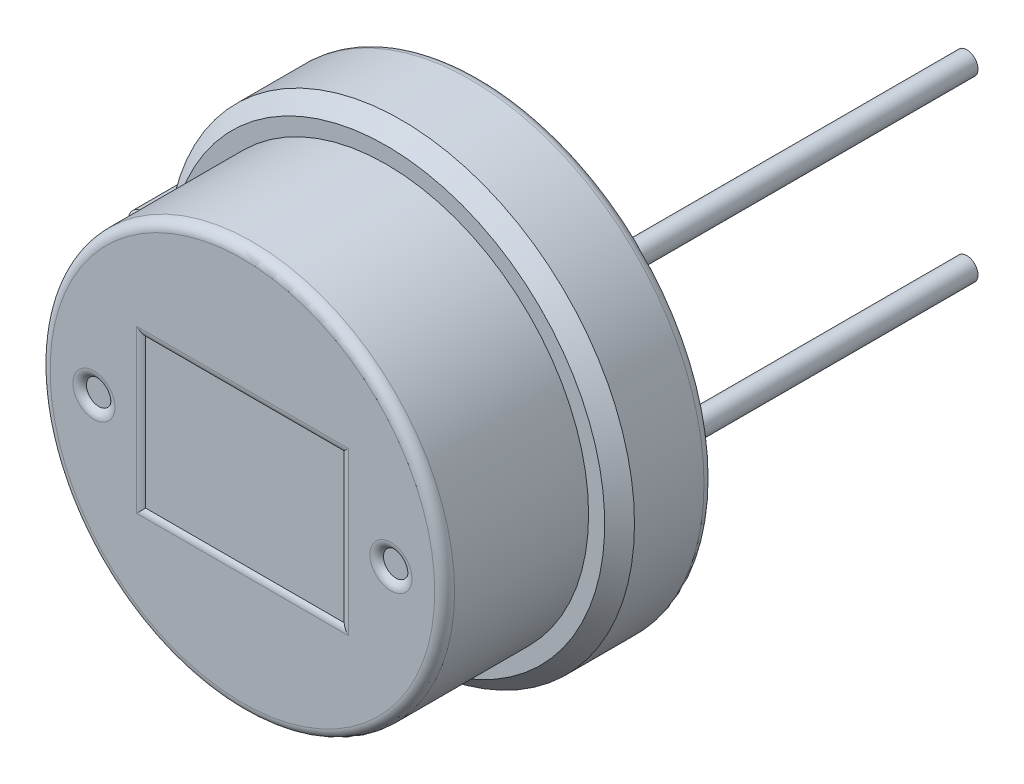
from build123d import *

# Parameters (mm, degrees)
EXTRUDE_423_DEPTH      = 1.9
SKETCH_3_R             = 4.075
EXTRUDE_611_DEPTH      = 2.9
SKETCH_6_W             = 4
SKETCH_6_H             = 3
CUT_EXTRUDE_758_DEPTH  = 0.05
SKETCH_7_R             = 0.25
CUT_EXTRUDE_1008_DEPTH = 0.1
SKETCH_4_R             = 0.225
EXTRUDE_1392_DEPTH     = 8
CHAMFER_1_SIZE         = 0.3
FILLET_1_R             = 0.2


# Some blends are built 0.0001 mm under size
with BuildPart() as part:
    # 草图2 → Extrude 423 (new body)
    with BuildSketch(Plane.XY):
        with BuildLine():
            Line((-5.5, 0.2), (-5.5, -0.2))
            ThreePointArc((-5.5, -0.2), (-5.412132034, -0.412132034), (-5.2, -0.5))
            Line((-5.2, -0.5), (-4.935585072, -0.5))
            ThreePointArc((-4.935585072, -0.5), (-4.741162851, -0.571526807), (-4.639449967, -0.752))
            ThreePointArc((-4.639449967, -0.752), (4.7, 0), (-4.639449967, 0.752))
            ThreePointArc((-4.639449967, 0.752), (-4.741162851, 0.571526807), (-4.935585072, 0.5))
            Line((-4.935585072, 0.5), (-5.2, 0.5))
            ThreePointArc((-5.2, 0.5), (-5.412132034, 0.412132034), (-5.5, 0.2))
        make_face()
    extrude(amount=EXTRUDE_423_DEPTH)

    # 草图3 → Extrude 611 (add)
    with BuildSketch(Plane.XY.offset(1.9)):
        Circle(SKETCH_3_R)
    extrude(amount=EXTRUDE_611_DEPTH)

    # 草图6 → Cut-Extrude 758 (cut)
    with BuildSketch(Plane.XY.offset(4.8)):
        Rectangle(SKETCH_6_W, SKETCH_6_H)
    extrude(amount=-CUT_EXTRUDE_758_DEPTH, mode=Mode.SUBTRACT)

    # 草图7 → Cut-Extrude 1008 (cut)
    with BuildSketch(Plane.XY.offset(4.8)):
        with Locations((-2.992635388, 0)):
            Circle(SKETCH_7_R)
        with Locations(Location((2.992635388, 0, 0), (0, 0, 180))):
            Circle(SKETCH_7_R)
    extrude(amount=-CUT_EXTRUDE_1008_DEPTH, mode=Mode.SUBTRACT)

    # 草图4 → Extrude 1392 (add)
    with BuildSketch(Plane(origin=(0, 0, 0), x_dir=(-1, 0, 0), z_dir=(0, 0, -1))):
        with Locations(Location((-1.796051224, -1.796051224, 0), (0, 0, 180))):
            Circle(SKETCH_4_R)
        with Locations(Location((-1.796051224, 1.796051224, 0), (0, 0, 180))):
            Circle(SKETCH_4_R)
        with Locations(Location((1.796051224, -1.796051224, 0), (0, 0, 180))):
            Circle(SKETCH_4_R)
    extrude(amount=EXTRUDE_1392_DEPTH)

    # 倒角1
    chamfer_1_edges = [part.edges().sort_by_distance(p)[0] for p in [
        (-4.741162851, 0.571526807, 1.9),
        (-5.067792536, 0.5, 1.9),
        (-5.412132034, 0.412132034, 1.9),
        (-5.5, 0, 1.9),
        (-5.412132034, -0.412132034, 1.9),
        (-5.067792536, -0.5, 1.9),
        (-4.741162851, -0.571526807, 1.9),
        (4.7, 0, 1.9),
    ]]
    chamfer(chamfer_1_edges, length=CHAMFER_1_SIZE - 0.0001)  # a hair under: the kernel refuses the full size

    # 圆角1
    # the kernel refuses this fillet: 0.2 mm, written as the material it takes off along each edge
    with BuildSketch(Plane(origin=(-4.935585072, -0.8, 0), x_dir=(0, 1, 0), z_dir=(-1, 0, 0))) as fillet_1_piece_1:
        with BuildLine():
            CenterArc((0.3 + FILLET_1_R, -FILLET_1_R), FILLET_1_R, 90, 90)
            Line((0.3, -FILLET_1_R), (0.3 - FILLET_1_R * 0.02, -FILLET_1_R))
            Line((0.3 - FILLET_1_R * 0.02, -FILLET_1_R), (0.3 - FILLET_1_R * 0.02, FILLET_1_R * 0.02))
            Line((0.3 - FILLET_1_R * 0.02, FILLET_1_R * 0.02), (0.3 + FILLET_1_R, FILLET_1_R * 0.02))
            Line((0.3 + FILLET_1_R, FILLET_1_R * 0.02), (0.3 + FILLET_1_R, 0))
        make_face()
    revolve(axis=Axis((-4.935585072, -0.8, 0), (0, 0, -1)), revolution_arc=80.793103779, mode=Mode.SUBTRACT)
    with BuildSketch(Plane(origin=(-5.2, -0.5, 0), x_dir=(0, 1, 0), z_dir=(1, 0, 0))) as fillet_1_piece_2:
        with BuildLine():
            CenterArc((FILLET_1_R, FILLET_1_R), FILLET_1_R, 180, 90)
            Line((0, FILLET_1_R), (-FILLET_1_R * 0.02, FILLET_1_R))
            Line((-FILLET_1_R * 0.02, FILLET_1_R), (-FILLET_1_R * 0.02, -FILLET_1_R * 0.02))
            Line((-FILLET_1_R * 0.02, -FILLET_1_R * 0.02), (FILLET_1_R, -FILLET_1_R * 0.02))
            Line((FILLET_1_R, -FILLET_1_R * 0.02), (FILLET_1_R, 0))
        make_face()
    extrude(amount=0.264414928, mode=Mode.SUBTRACT)
    with BuildSketch(Plane(origin=(-5.2, -0.2, 0), x_dir=(-1, 0, 0), z_dir=(0, 1, 0))) as fillet_1_piece_3:
        with BuildLine():
            CenterArc((0.3 - FILLET_1_R, FILLET_1_R), FILLET_1_R, 270, 90)
            Line((0.3, FILLET_1_R), (0.3 + FILLET_1_R * 0.02, FILLET_1_R))
            Line((0.3 + FILLET_1_R * 0.02, FILLET_1_R), (0.3 + FILLET_1_R * 0.02, -FILLET_1_R * 0.02))
            Line((0.3 + FILLET_1_R * 0.02, -FILLET_1_R * 0.02), (0.3 - FILLET_1_R, -FILLET_1_R * 0.02))
            Line((0.3 - FILLET_1_R, -FILLET_1_R * 0.02), (0.3 - FILLET_1_R, 0))
        make_face()
    revolve(axis=Axis((-5.2, -0.2, 0), (0, 0, 1)), revolution_arc=90, mode=Mode.SUBTRACT)
    with BuildSketch(Plane(origin=(-5.5, 0.2, 0), x_dir=(1, 0, 0), z_dir=(0, -1, 0))) as fillet_1_piece_4:
        with BuildLine():
            CenterArc((FILLET_1_R, FILLET_1_R), FILLET_1_R, 180, 90)
            Line((0, FILLET_1_R), (-FILLET_1_R * 0.02, FILLET_1_R))
            Line((-FILLET_1_R * 0.02, FILLET_1_R), (-FILLET_1_R * 0.02, -FILLET_1_R * 0.02))
            Line((-FILLET_1_R * 0.02, -FILLET_1_R * 0.02), (FILLET_1_R, -FILLET_1_R * 0.02))
            Line((FILLET_1_R, -FILLET_1_R * 0.02), (FILLET_1_R, 0))
        make_face()
    extrude(amount=0.4, mode=Mode.SUBTRACT)
    with BuildSketch(Plane(origin=(-5.2, 0.2, 0), x_dir=(0, 1, 0), z_dir=(1, 0, 0))) as fillet_1_piece_5:
        with BuildLine():
            CenterArc((0.3 - FILLET_1_R, FILLET_1_R), FILLET_1_R, 270, 90)
            Line((0.3 - FILLET_1_R, 0), (0.3 - FILLET_1_R, -FILLET_1_R * 0.02))
            Line((0.3 - FILLET_1_R, -FILLET_1_R * 0.02), (0.3 + FILLET_1_R * 0.02, -FILLET_1_R * 0.02))
            Line((0.3 + FILLET_1_R * 0.02, -FILLET_1_R * 0.02), (0.3 + FILLET_1_R * 0.02, FILLET_1_R))
            Line((0.3 + FILLET_1_R * 0.02, FILLET_1_R), (0.3, FILLET_1_R))
        make_face()
    revolve(axis=Axis((-5.2, 0.2, 0), (0, 0, 1)), revolution_arc=90, mode=Mode.SUBTRACT)
    with BuildSketch(Plane(origin=(-4.935585072, 0.5, 0), x_dir=(0, 0, 1), z_dir=(-1, 0, 0))) as fillet_1_piece_6:
        with BuildLine():
            CenterArc((FILLET_1_R, -FILLET_1_R), FILLET_1_R, 90, 90)
            Line((0, -FILLET_1_R), (-FILLET_1_R * 0.02, -FILLET_1_R))
            Line((-FILLET_1_R * 0.02, -FILLET_1_R), (-FILLET_1_R * 0.02, FILLET_1_R * 0.02))
            Line((-FILLET_1_R * 0.02, FILLET_1_R * 0.02), (FILLET_1_R, FILLET_1_R * 0.02))
            Line((FILLET_1_R, FILLET_1_R * 0.02), (FILLET_1_R, 0))
        make_face()
    extrude(amount=0.264414928, mode=Mode.SUBTRACT)
    with BuildSketch(Plane(origin=(-4.935585072, 0.8, 0), x_dir=(0.9871170143402451, -0.16000000000000056, 0), z_dir=(0.16000000000000056, 0.9871170143402451, 0))) as fillet_1_piece_7:
        with BuildLine():
            CenterArc((0.3 + FILLET_1_R, -FILLET_1_R), FILLET_1_R, 90, 90)
            Line((0.3, -FILLET_1_R), (0.3 - FILLET_1_R * 0.02, -FILLET_1_R))
            Line((0.3 - FILLET_1_R * 0.02, -FILLET_1_R), (0.3 - FILLET_1_R * 0.02, FILLET_1_R * 0.02))
            Line((0.3 - FILLET_1_R * 0.02, FILLET_1_R * 0.02), (0.3 + FILLET_1_R, FILLET_1_R * 0.02))
            Line((0.3 + FILLET_1_R, FILLET_1_R * 0.02), (0.3 + FILLET_1_R, 0))
        make_face()
    revolve(axis=Axis((-4.935585072, 0.8, 0), (0, 0, -1)), revolution_arc=80.793103779, mode=Mode.SUBTRACT)
    with BuildSketch(Plane(origin=(0, 0, 4.8), x_dir=(1, 0, 0), z_dir=(0, -1, 0))) as fillet_1_piece_8:
        with BuildLine():
            CenterArc((4.075 - FILLET_1_R, -FILLET_1_R), FILLET_1_R, 0, 90)
            Line((4.075 - FILLET_1_R, 0), (4.075 - FILLET_1_R, FILLET_1_R * 0.02))
            Line((4.075 - FILLET_1_R, FILLET_1_R * 0.02), (4.075 + FILLET_1_R * 0.02, FILLET_1_R * 0.02))
            Line((4.075 + FILLET_1_R * 0.02, FILLET_1_R * 0.02), (4.075 + FILLET_1_R * 0.02, -FILLET_1_R))
            Line((4.075 + FILLET_1_R * 0.02, -FILLET_1_R), (4.075, -FILLET_1_R))
        make_face()
    revolve(axis=Axis((0, 0, 4.8), (0, 0, 1)), mode=Mode.SUBTRACT)
    with BuildSketch(Plane(origin=(0, 0, 0), x_dir=(-0.9871170143402452, -0.16000000000000036, 0), z_dir=(-0.16000000000000036, 0.9871170143402452, 0))) as fillet_1_piece_9:
        with BuildLine():
            CenterArc((4.7 - FILLET_1_R, FILLET_1_R), FILLET_1_R, 270, 90)
            Line((4.7, FILLET_1_R), (4.7 + FILLET_1_R * 0.02, FILLET_1_R))
            Line((4.7 + FILLET_1_R * 0.02, FILLET_1_R), (4.7 + FILLET_1_R * 0.02, -FILLET_1_R * 0.02))
            Line((4.7 + FILLET_1_R * 0.02, -FILLET_1_R * 0.02), (4.7 - FILLET_1_R, -FILLET_1_R * 0.02))
            Line((4.7 - FILLET_1_R, -FILLET_1_R * 0.02), (4.7 - FILLET_1_R, 0))
        make_face()
    revolve(axis=Axis((0, 0, 0), (0, 0, 1)), revolution_arc=341.586207557, mode=Mode.SUBTRACT)
    with BuildSketch(Plane(origin=(2.992635388, 0, 4.8), x_dir=(-1, 0, 0), z_dir=(0, 1, 0))) as fillet_1_piece_10:
        with BuildLine():
            CenterArc((0.423205081, -0.2), FILLET_1_R, 90, 60)
            Line((0.25, -0.1), (0.246535898, -0.098))
            ThreePointArc((0.246535898, -0.098), (0.246, -0.05), (0.246, 0))
            Line((0.246, 0), (0.25, 0.004))
            Line((0.25, 0.004), (0.423205081, 0.004))
            Line((0.423205081, 0.004), (0.423205081, 0))
        make_face()
    revolve(axis=Axis((2.992635388, 0, 4.8), (0, 0, 1)), mode=Mode.SUBTRACT)
    with BuildSketch(Plane(origin=(-2.992635388, 0, 4.8), x_dir=(1, 0, 0), z_dir=(0, -1, 0))) as fillet_1_piece_11:
        with BuildLine():
            CenterArc((0.423205081, -0.2), FILLET_1_R, 90, 60)
            Line((0.25, -0.1), (0.246535898, -0.098))
            ThreePointArc((0.246535898, -0.098), (0.246, -0.05), (0.246, 0))
            Line((0.246, 0), (0.25, 0.004))
            Line((0.25, 0.004), (0.423205081, 0.004))
            Line((0.423205081, 0.004), (0.423205081, 0))
        make_face()
    revolve(axis=Axis((-2.992635388, 0, 4.8), (0, 0, 1)), mode=Mode.SUBTRACT)
    with BuildSketch(Plane(origin=(-2, 1.5, 4.8), x_dir=(0, 1, 0), z_dir=(1, 0, 0)), Plane(origin=(2, -1.5, 4.8), x_dir=(0, -1, 0), z_dir=(-1, 0, 0))) as fillet_1_piece_12:
        with BuildLine():
            CenterArc((0.132287566, -0.2), FILLET_1_R, 90, 41.409622109)
            Line((0, -0.05), (-0.002645751, -0.047))
            ThreePointArc((-0.002645751, -0.047), (-0.004, -0.025), (-0.004, 0))
            Line((-0.004, 0), (0, 0.004))
            Line((0, 0.004), (0.132287566, 0.004))
            Line((0.132287566, 0.004), (0.132287566, 0))
        make_face()
    extrude(amount=4, mode=Mode.SUBTRACT)
    with BuildSketch(Plane(origin=(-2, -1.5, 4.8), x_dir=(-1, 0, 0), z_dir=(0, 1, 0)), Plane(origin=(2, 1.5, 4.8), x_dir=(1, 0, 0), z_dir=(0, -1, 0))) as fillet_1_piece_13:
        with BuildLine():
            CenterArc((0.132287566, -0.2), FILLET_1_R, 90, 41.409622109)
            Line((0, -0.05), (-0.002645751, -0.047))
            ThreePointArc((-0.002645751, -0.047), (-0.004, -0.025), (-0.004, 0))
            Line((-0.004, 0), (0, 0.004))
            Line((0, 0.004), (0.132287566, 0.004))
            Line((0.132287566, 0.004), (0.132287566, 0))
        make_face()
    extrude(amount=3, mode=Mode.SUBTRACT)
    with BuildSketch(Plane(origin=(-2, -1.5, 4.8), x_dir=(-1, 0, 0), z_dir=(0, 1, 0))) as fillet_1_piece_14a_section:
        with BuildLine():
            CenterArc((0.132287566, -0.2), FILLET_1_R, 90, 41.409622109)
            Line((0, -0.05), (-0.002645751, -0.047))
            ThreePointArc((-0.002645751, -0.047), (-0.004, -0.025), (-0.004, 0))
            Line((-0.004, 0), (0, 0.004))
            Line((0, 0.004), (0.132287566, 0.004))
            Line((0.132287566, 0.004), (0.132287566, 0))
        make_face()
    fillet_1_piece_14a = extrude(amount=3.330718914, mode=Mode.PRIVATE)
    fillet_1_piece_14a = split(fillet_1_piece_14a, bisect_by=Plane(origin=(-2.036281513, 1.5, 4.788045002), z_dir=(0, 1, 0)), keep=Keep.TOP, mode=Mode.PRIVATE)
    with BuildSketch(Plane(origin=(-2.330718914, 1.5, 4.8), x_dir=(0, 1, 0), z_dir=(1, 0, 0))) as fillet_1_piece_14b_section:
        with BuildLine():
            CenterArc((0.132287566, -0.2), FILLET_1_R, 90, 41.409622109)
            Line((0, -0.05), (-0.002645751, -0.047))
            ThreePointArc((-0.002645751, -0.047), (-0.004, -0.025), (-0.004, 0))
            Line((-0.004, 0), (0, 0.004))
            Line((0, 0.004), (0.132287566, 0.004))
            Line((0.132287566, 0.004), (0.132287566, 0))
        make_face()
    fillet_1_piece_14b = extrude(amount=4.330718914, mode=Mode.PRIVATE)
    fillet_1_piece_14b = split(fillet_1_piece_14b, bisect_by=Plane(origin=(-2, 1.536281513, 4.788045002), z_dir=(-1, 0, 0)), keep=Keep.TOP, mode=Mode.PRIVATE)
    fillet_1_piece_14 = fillet_1_piece_14a & fillet_1_piece_14b
    add(fillet_1_piece_14, mode=Mode.SUBTRACT)
    with BuildSketch(Plane(origin=(-2, 1.5, 4.8), x_dir=(0, 1, 0), z_dir=(1, 0, 0))) as fillet_1_piece_15a_section:
        with BuildLine():
            CenterArc((0.132287566, -0.2), FILLET_1_R, 90, 41.409622109)
            Line((0, -0.05), (-0.002645751, -0.047))
            ThreePointArc((-0.002645751, -0.047), (-0.004, -0.025), (-0.004, 0))
            Line((-0.004, 0), (0, 0.004))
            Line((0, 0.004), (0.132287566, 0.004))
            Line((0.132287566, 0.004), (0.132287566, 0))
        make_face()
    fillet_1_piece_15a = extrude(amount=4.330718914, mode=Mode.PRIVATE)
    fillet_1_piece_15a = split(fillet_1_piece_15a, bisect_by=Plane(origin=(2, 1.536281513, 4.788045002), z_dir=(1, 0, 0)), keep=Keep.TOP, mode=Mode.PRIVATE)
    with BuildSketch(Plane(origin=(2, 1.830718914, 4.8), x_dir=(1, 0, 0), z_dir=(0, -1, 0))) as fillet_1_piece_15b_section:
        with BuildLine():
            CenterArc((0.132287566, -0.2), FILLET_1_R, 90, 41.409622109)
            Line((0, -0.05), (-0.002645751, -0.047))
            ThreePointArc((-0.002645751, -0.047), (-0.004, -0.025), (-0.004, 0))
            Line((-0.004, 0), (0, 0.004))
            Line((0, 0.004), (0.132287566, 0.004))
            Line((0.132287566, 0.004), (0.132287566, 0))
        make_face()
    fillet_1_piece_15b = extrude(amount=3.330718914, mode=Mode.PRIVATE)
    fillet_1_piece_15b = split(fillet_1_piece_15b, bisect_by=Plane(origin=(2.036281513, 1.5, 4.788045002), z_dir=(0, 1, 0)), keep=Keep.TOP, mode=Mode.PRIVATE)
    fillet_1_piece_15 = fillet_1_piece_15a & fillet_1_piece_15b
    add(fillet_1_piece_15, mode=Mode.SUBTRACT)
    with BuildSketch(Plane(origin=(-2, -1.830718914, 4.8), x_dir=(-1, 0, 0), z_dir=(0, 1, 0))) as fillet_1_piece_16a_section:
        with BuildLine():
            CenterArc((0.132287566, -0.2), FILLET_1_R, 90, 41.409622109)
            Line((0, -0.05), (-0.002645751, -0.047))
            ThreePointArc((-0.002645751, -0.047), (-0.004, -0.025), (-0.004, 0))
            Line((-0.004, 0), (0, 0.004))
            Line((0, 0.004), (0.132287566, 0.004))
            Line((0.132287566, 0.004), (0.132287566, 0))
        make_face()
    fillet_1_piece_16a = extrude(amount=3.330718914, mode=Mode.PRIVATE)
    fillet_1_piece_16a = split(fillet_1_piece_16a, bisect_by=Plane(origin=(-2.036281513, -1.5, 4.788045002), z_dir=(0, -1, 0)), keep=Keep.TOP, mode=Mode.PRIVATE)
    with BuildSketch(Plane(origin=(2, -1.5, 4.8), x_dir=(0, -1, 0), z_dir=(-1, 0, 0))) as fillet_1_piece_16b_section:
        with BuildLine():
            CenterArc((0.132287566, -0.2), FILLET_1_R, 90, 41.409622109)
            Line((0, -0.05), (-0.002645751, -0.047))
            ThreePointArc((-0.002645751, -0.047), (-0.004, -0.025), (-0.004, 0))
            Line((-0.004, 0), (0, 0.004))
            Line((0, 0.004), (0.132287566, 0.004))
            Line((0.132287566, 0.004), (0.132287566, 0))
        make_face()
    fillet_1_piece_16b = extrude(amount=4.330718914, mode=Mode.PRIVATE)
    fillet_1_piece_16b = split(fillet_1_piece_16b, bisect_by=Plane(origin=(-2, -1.536281513, 4.788045002), z_dir=(-1, 0, 0)), keep=Keep.TOP, mode=Mode.PRIVATE)
    fillet_1_piece_16 = fillet_1_piece_16a & fillet_1_piece_16b
    add(fillet_1_piece_16, mode=Mode.SUBTRACT)
    with BuildSketch(Plane(origin=(2.330718914, -1.5, 4.8), x_dir=(0, -1, 0), z_dir=(-1, 0, 0))) as fillet_1_piece_17a_section:
        with BuildLine():
            CenterArc((0.132287566, -0.2), FILLET_1_R, 90, 41.409622109)
            Line((0, -0.05), (-0.002645751, -0.047))
            ThreePointArc((-0.002645751, -0.047), (-0.004, -0.025), (-0.004, 0))
            Line((-0.004, 0), (0, 0.004))
            Line((0, 0.004), (0.132287566, 0.004))
            Line((0.132287566, 0.004), (0.132287566, 0))
        make_face()
    fillet_1_piece_17a = extrude(amount=4.330718914, mode=Mode.PRIVATE)
    fillet_1_piece_17a = split(fillet_1_piece_17a, bisect_by=Plane(origin=(2, -1.536281513, 4.788045002), z_dir=(1, 0, 0)), keep=Keep.TOP, mode=Mode.PRIVATE)
    with BuildSketch(Plane(origin=(2, 1.5, 4.8), x_dir=(1, 0, 0), z_dir=(0, -1, 0))) as fillet_1_piece_17b_section:
        with BuildLine():
            CenterArc((0.132287566, -0.2), FILLET_1_R, 90, 41.409622109)
            Line((0, -0.05), (-0.002645751, -0.047))
            ThreePointArc((-0.002645751, -0.047), (-0.004, -0.025), (-0.004, 0))
            Line((-0.004, 0), (0, 0.004))
            Line((0, 0.004), (0.132287566, 0.004))
            Line((0.132287566, 0.004), (0.132287566, 0))
        make_face()
    fillet_1_piece_17b = extrude(amount=3.330718914, mode=Mode.PRIVATE)
    fillet_1_piece_17b = split(fillet_1_piece_17b, bisect_by=Plane(origin=(2.036281513, -1.5, 4.788045002), z_dir=(0, -1, 0)), keep=Keep.TOP, mode=Mode.PRIVATE)
    fillet_1_piece_17 = fillet_1_piece_17a & fillet_1_piece_17b
    add(fillet_1_piece_17, mode=Mode.SUBTRACT)


solid = part.part
